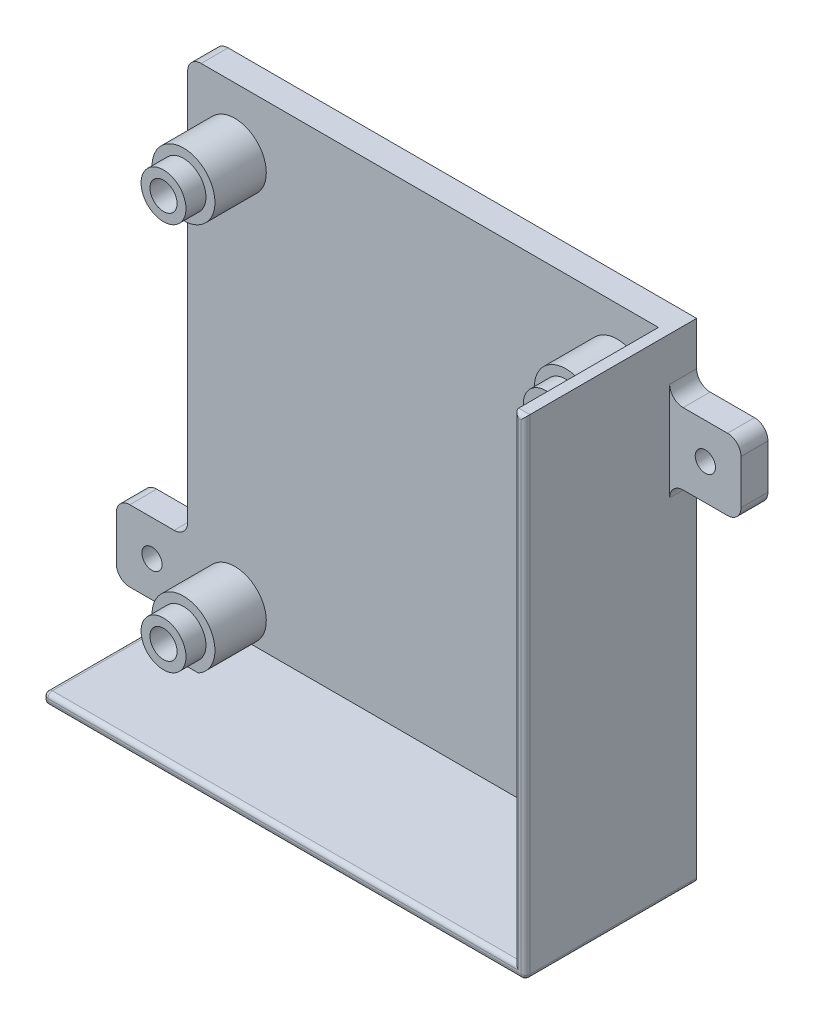
from build123d import *

# Parameters (mm, degrees)
SKETCH1_W            = 104.775
SKETCH1_H            = 106.3625
BOSS_EXTRUDE1_DEPTH  = 6
BOSS_EXTRUDE2_DEPTH  = 38.1
SKETCH3_R            = 5
SKETCH3_R_2          = 3.025
BOSS_EXTRUDE3_DEPTH  = 15.875
SKETCH4_R            = 7
SKETCH4_R_2          = 3.025
BOSS_EXTRUDE4_DEPTH  = 11.43
SKETCH6_W            = 15.875
SKETCH6_H            = 15.875
BOSS_EXTRUDE5_DEPTH  = 6
M4_CLEARANCE_HOLE1_D = 4.5
FILLET2_R            = 3
FILLET3_R            = 1


with BuildPart() as part:
    # Sketch1 → Boss-Extrude1 (new body)
    with BuildSketch(Plane.XY):
        Rectangle(SKETCH1_W, SKETCH1_H)
    extrude(amount=BOSS_EXTRUDE1_DEPTH)

    # Sketch2 → Boss-Extrude2 (add)
    with BuildSketch(Plane.XY):
        Polygon((-52.3875, -53.18125), (-52.3875, -55.68125), (54.8875, -55.68125), (54.8875, 53.18125), (52.3875, 53.18125), (52.3875, -53.18125), align=None)
    extrude(amount=BOSS_EXTRUDE2_DEPTH)

    # Sketch3 → Boss-Extrude3 (add)
    # profile 1 of 4: a face of its own
    with BuildSketch(Plane.XY.offset(6)):
        with Locations((43.208, 39.35095)):
            Circle(SKETCH3_R)
        with Locations((43.208, 39.35095)):
            Circle(SKETCH3_R_2, mode=Mode.SUBTRACT)
    # profile 2 of 4: a face of its own
    with BuildSketch(Plane.XY.offset(6)):
        with Locations((-41.882, 39.35095)):
            Circle(SKETCH3_R)
        with Locations((-41.882, 39.35095)):
            Circle(SKETCH3_R_2, mode=Mode.SUBTRACT)
    # profile 3 of 4: a face of its own
    with BuildSketch(Plane.XY.offset(6)):
        with Locations((-41.882, -47.00905)):
            Circle(SKETCH3_R)
        with Locations((-41.882, -47.00905)):
            Circle(SKETCH3_R_2, mode=Mode.SUBTRACT)
    # profile 4 of 4: a face of its own
    with BuildSketch(Plane.XY.offset(6)):
        with Locations((43.208, -47.00905)):
            Circle(SKETCH3_R)
        with Locations((43.208, -47.00905)):
            Circle(SKETCH3_R_2, mode=Mode.SUBTRACT)
    extrude(amount=BOSS_EXTRUDE3_DEPTH)

    # Sketch4 → Boss-Extrude4 (add)
    # profile 1 of 4: a face of its own
    with BuildSketch(Plane.XY.offset(6)):
        with Locations((43.208, 39.35095)):
            Circle(SKETCH4_R)
        with Locations((43.208, 39.35095)):
            Circle(SKETCH4_R_2, mode=Mode.SUBTRACT)
    # profile 2 of 4: a face of its own
    with BuildSketch(Plane.XY.offset(6)):
        with Locations((-41.882, 39.35095)):
            Circle(SKETCH4_R)
        with Locations((-41.882, 39.35095)):
            Circle(SKETCH4_R_2, mode=Mode.SUBTRACT)
    # profile 3 of 4: a face of its own
    with BuildSketch(Plane.XY.offset(6)):
        with Locations((-41.882, -47.00905)):
            Circle(SKETCH4_R)
        with Locations((-41.882, -47.00905)):
            Circle(SKETCH4_R_2, mode=Mode.SUBTRACT)
    # profile 4 of 4: a face of its own
    with BuildSketch(Plane.XY.offset(6)):
        with Locations((43.208, -47.00905)):
            Circle(SKETCH4_R)
        with Locations((43.208, -47.00905)):
            Circle(SKETCH4_R_2, mode=Mode.SUBTRACT)
    extrude(amount=BOSS_EXTRUDE4_DEPTH)

    # Sketch6 → Boss-Extrude5 (add)
    with BuildSketch(Plane.XY):
        with Locations((-60.325, -47.74375)):
            Rectangle(SKETCH6_W, SKETCH6_H)
        with Locations((62.825, 32.54375)):
            Rectangle(SKETCH6_W, SKETCH6_H)
    extrude(amount=BOSS_EXTRUDE5_DEPTH)

    # M4 Clearance Hole1 (through all)
    with Locations(Plane.XY.offset(6)):
        with Locations((62.825, 32.54375), (-60.325, -47.74375)):
            Hole(M4_CLEARANCE_HOLE1_D / 2)

    # Fillet2
    fillet2_edges = [part.edges().sort_by_distance(p)[0] for p in [
        (70.7625, 24.60625, 3),
        (70.7625, 40.48125, 3),
        (54.8875, 40.48125, 3),
        (54.8875, 24.60625, 3),
        (-68.2625, -55.68125, 3),
        (-68.2625, -39.80625, 3),
        (-52.3875, -39.80625, 3),
        (-52.3875, 53.18125, 3),
    ]]
    fillet(fillet2_edges, radius=FILLET2_R)

    # Fillet3
    fillet3_edges = [part.edges().sort_by_distance(p)[0] for p in [
        (52.3875, 0, 38.1),
        (53.6375, 53.18125, 38.1),
        (54.8875, -1.25, 38.1),
        (-52.3875, -54.43125, 38.1),
        (0, -53.18125, 38.1),
        (54.8875, -55.68125, 19.05),
        (1.25, -55.68125, 38.1),
        (-52.3875, -53.18125, 22.05),
        (-52.3875, -55.68125, 22.05),
    ]]
    fillet(fillet3_edges, radius=FILLET3_R)


solid = part.part
